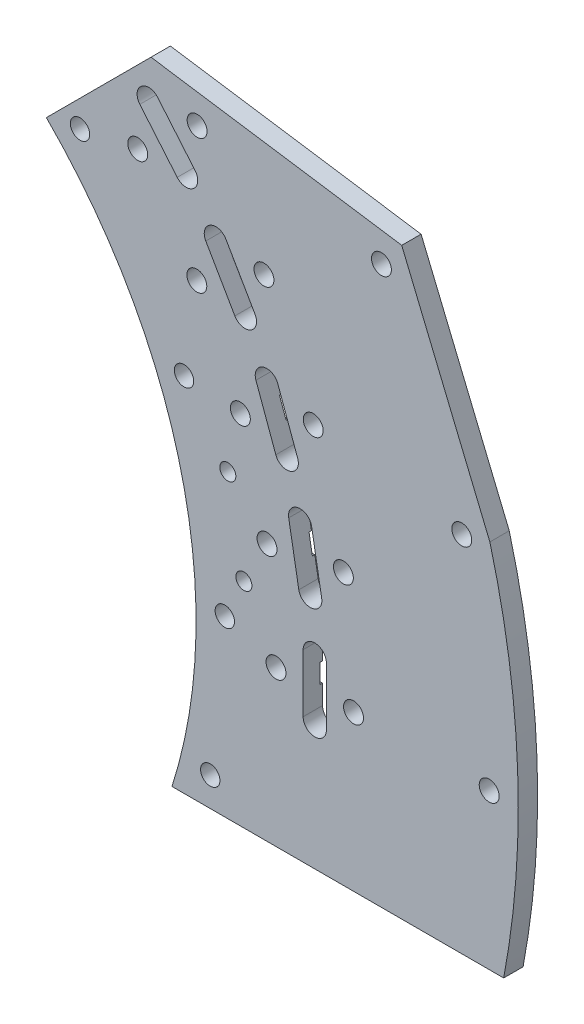
from build123d import *

# Parameters (mm, degrees)
SKETCH1_R           = 3.175
SKETCH1_R_2         = 3.2639
SKETCH1_R_3         = 2.6289
BOSS_EXTRUDE1_DEPTH = 6.35
SKETCH2_R           = 3.175
CUT_EXTRUDE1_DEPTH  = 0.79375


with BuildPart() as part:
    # Sketch1 → Boss-Extrude1 (new body)
    with BuildSketch(Plane.XY):
        with BuildLine():
            ThreePointArc((167.48125, 0), (165.496965553, -25.70454229), (159.591131024, -50.8))
            Line((159.591131024, -50.8), (268.282803213, -50.8))
            ThreePointArc((268.282803213, -50.8), (272.859757692, 10.190933821), (263.746046868, 70.670540265))
            Line((263.746046868, 70.670540265), (234.864133392, 140.397647486))
            Line((234.864133392, 140.397647486), (234.123018172, 140.508771477))
            Line((234.123018172, 140.508771477), (152.715190262, 152.715190262))
            Line((152.715190262, 152.715190262), (118.427127597, 118.427127597))
            ThreePointArc((118.427127597, 118.427127597), (154.732498954, 64.092299607), (167.48125, 0))
        make_face()
        with Locations((172.12665951, -41.275)):
            Circle(SKETCH1_R, mode=Mode.SUBTRACT)
        with Locations((193.675, 0)):
            Circle(SKETCH1_R_2, mode=Mode.SUBTRACT)
        with Locations((176.898422575, 6.177429038)):
            Circle(SKETCH1_R, mode=Mode.SUBTRACT)
        with Locations((183.141207032, 19.248916511)):
            Circle(SKETCH1_R_3, mode=Mode.SUBTRACT)
        with Locations((190.732641565, 33.63131081)):
            Circle(SKETCH1_R_2, mode=Mode.SUBTRACT)
        with Locations((177.875240911, 47.661527156)):
            Circle(SKETCH1_R_3, mode=Mode.SUBTRACT)
        with BuildLine():
            Line((202.565, -9.525), (202.565, 0))
            Line((202.565, 0), (202.565, 9.525))
            ThreePointArc((202.565, 9.525), (206.375, 13.335), (210.185, 9.525))
            Line((210.185, 9.525), (210.185, 0))
            Line((210.185, 0), (210.185, -9.525))
            ThreePointArc((210.185, -9.525), (206.375, -13.335), (202.565, -9.525))
        make_face(mode=Mode.SUBTRACT)
        with Locations((219.075, 0)):
            Circle(SKETCH1_R_2, mode=Mode.SUBTRACT)
        with Locations((263.525, 0)):
            Circle(SKETCH1_R_2, mode=Mode.SUBTRACT)
        with BuildLine():
            Line((201.141581381, 25.794749262), (199.487582489, 35.175043109))
            Line((199.487582489, 35.175043109), (197.833583597, 44.555336957))
            ThreePointArc((197.833583597, 44.555336957), (200.924101579, 48.969054052), (205.337818675, 45.87853607))
            Line((205.337818675, 45.87853607), (206.991817567, 36.498242223))
            Line((206.991817567, 36.498242223), (208.645816459, 27.117948375))
            ThreePointArc((208.645816459, 27.117948375), (205.555298477, 22.70423128), (201.141581381, 25.794749262))
        make_face(mode=Mode.SUBTRACT)
        with Locations((215.746758491, 38.041974522)):
            Circle(SKETCH1_R_2, mode=Mode.SUBTRACT)
        with Locations((163.532451502, 67.7373593)):
            Circle(SKETCH1_R, mode=Mode.SUBTRACT)
        with Locations((181.994968331, 66.240751259)):
            Circle(SKETCH1_R_2, mode=Mode.SUBTRACT)
        with BuildLine():
            Line((193.606577595, 60.33073812), (190.348835729, 69.281310333))
            Line((190.348835729, 69.281310333), (187.091093864, 78.231882546))
            ThreePointArc((187.091093864, 78.231882546), (189.368226003, 83.115208177), (194.251551635, 80.838076038))
            Line((194.251551635, 80.838076038), (197.5092935, 71.887503825))
            Line((197.5092935, 71.887503825), (200.767035365, 62.936931612))
            ThreePointArc((200.767035365, 62.936931612), (198.489903226, 58.053605981), (193.606577595, 60.33073812))
        make_face(mode=Mode.SUBTRACT)
        with Locations((167.727470078, 96.8375)):
            Circle(SKETCH1_R_2, mode=Mode.SUBTRACT)
        with Locations((129.454176147, 120.717972221)):
            Circle(SKETCH1_R, mode=Mode.SUBTRACT)
        with Locations((148.363657521, 124.491890306)):
            Circle(SKETCH1_R_2, mode=Mode.SUBTRACT)
        with BuildLine():
            Line((180.188935918, 93.033608029), (175.426435918, 101.2825))
            Line((175.426435918, 101.2825), (170.663935918, 109.531391971))
            ThreePointArc((170.663935918, 109.531391971), (172.058492706, 114.735948759), (177.263049494, 113.341391971))
            Line((177.263049494, 113.341391971), (182.025549494, 105.0925))
            Line((182.025549494, 105.0925), (186.788049494, 96.843608029))
            ThreePointArc((186.788049494, 96.843608029), (185.393492706, 91.639051241), (180.188935918, 93.033608029))
        make_face(mode=Mode.SUBTRACT)
        with Locations((189.724515334, 109.5375)):
            Circle(SKETCH1_R_2, mode=Mode.SUBTRACT)
        with BuildLine():
            Line((161.296344603, 122.909698835), (155.17379262, 130.206272156))
            Line((155.17379262, 130.206272156), (149.051240638, 137.502845477))
            ThreePointArc((149.051240638, 137.502845477), (149.520849174, 142.870495598), (154.888499295, 142.400887063))
            Line((154.888499295, 142.400887063), (161.011051277, 135.104313742))
            Line((161.011051277, 135.104313742), (167.133603259, 127.807740421))
            ThreePointArc((167.133603259, 127.807740421), (166.663994724, 122.4400903), (161.296344603, 122.909698835))
        make_face(mode=Mode.SUBTRACT)
        with Locations((167.821186376, 140.818695592)):
            Circle(SKETCH1_R_2, mode=Mode.SUBTRACT)
        with Locations((205.863160899, 74.928062899)):
            Circle(SKETCH1_R_2, mode=Mode.SUBTRACT)
        with Locations((254.545603373, 68.205288861)):
            Circle(SKETCH1_R_2, mode=Mode.SUBTRACT)
        with Locations((228.219344532, 131.7625)):
            Circle(SKETCH1_R_2, mode=Mode.SUBTRACT)
    extrude(amount=BOSS_EXTRUDE1_DEPTH)

    # Sketch2 → Cut-Extrude1 (cut)
    with BuildSketch(Plane.XY):
        with Locations((202.565, 0)):
            Circle(SKETCH2_R)
        with Locations((210.185, 0)):
            Circle(SKETCH2_R)
        with Locations((199.487582489, 35.175043109)):
            Circle(SKETCH2_R)
        with Locations((206.991817567, 36.498242223)):
            Circle(SKETCH2_R)
        with Locations((190.348835729, 69.281310333)):
            Circle(SKETCH2_R)
        with Locations((197.5092935, 71.887503825)):
            Circle(SKETCH2_R)
        with Locations((175.426435918, 101.2825)):
            Circle(SKETCH2_R)
        with Locations((182.025549494, 105.0925)):
            Circle(SKETCH2_R)
        with Locations((155.17379262, 130.206272156)):
            Circle(SKETCH2_R)
        with Locations((161.011051277, 135.104313742)):
            Circle(SKETCH2_R)
    extrude(amount=CUT_EXTRUDE1_DEPTH, mode=Mode.SUBTRACT)


solid = part.part
